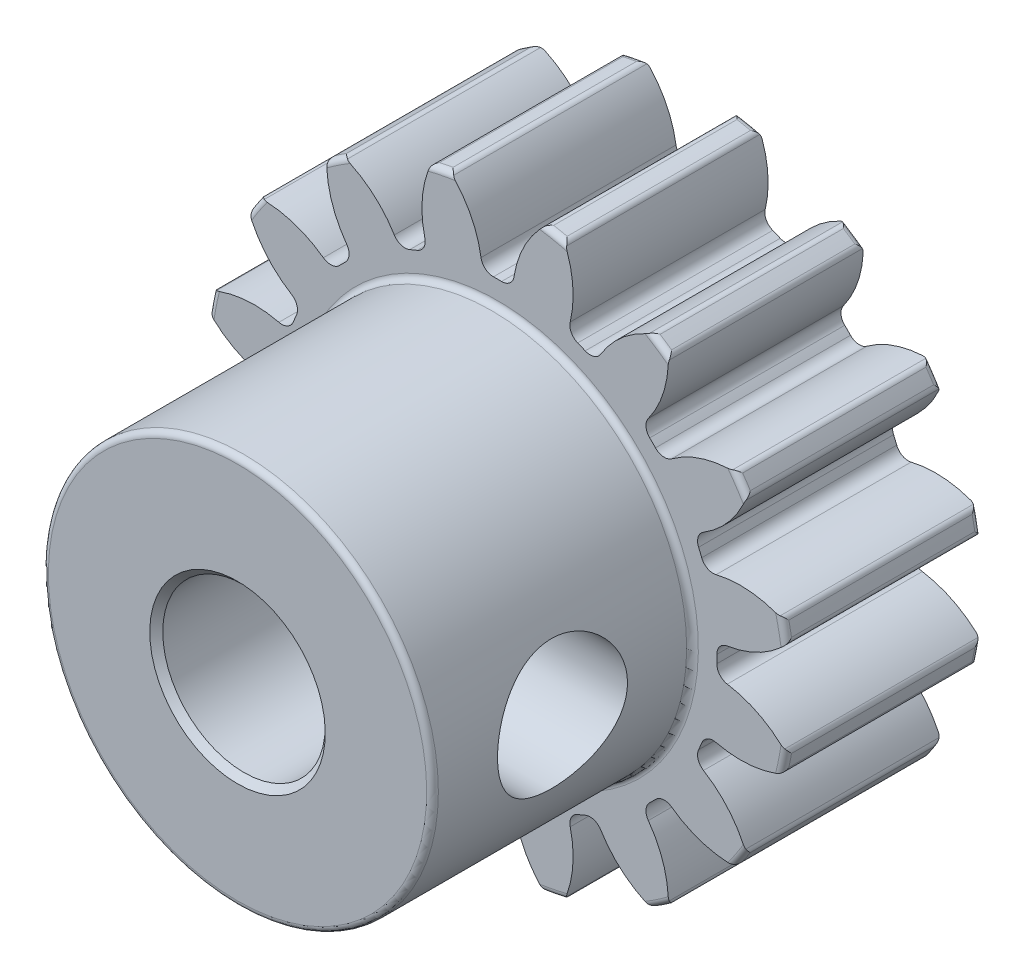
from build123d import *

# Parameters (mm, degrees)
FILLET2_R                = 0.18
CUT_EXTRUDE2_DEPTH       = 16.033296498
FILLET3_R                = 0.380000002
FILLET4_START            = -1
FILLET4_DEPTH            = 8
CIRPATTERN1_COUNT        = 16
FILLET3_OF_CIRPATTERN1_R = 0.380000002
CUT_EXTRUDE3_REACH       = 24.265
CUT_EXTRUDE3_END_RADIUS  = 2.5
SKETCH8_R                = 2
CHAMFER1_SIZE            = 0.2


with BuildPart() as part:
    # Sketch4 → Revolve1 (revolve)
    with BuildSketch(Plane(origin=(0, 0, 0), x_dir=(0, 0, -1), z_dir=(1, 0, 0))):
        Polygon((-14, 2.5), (-14, 6), (-6, 6), (-6, 9), (0, 9), (0, 2.5), align=None)
    revolve(axis=Axis((0, 0, 6), (0, 0, 1)))

    # Fillet2
    fillet2_edges = [part.edges().sort_by_distance(p)[0] for p in [
        (0, -9, 0),
        (0, -9, 6),
        (0, -6, 6),
        (0, -6, 14),
    ]]
    fillet(fillet2_edges, radius=FILLET2_R)

    # Sketch7 → Cut-Extrude2 (cut, through all)
    with BuildSketch(Plane.XY.offset(6)):
        with BuildLine():
            ThreePointArc((-1.449653973, 8.88248295), (0, 9), (1.449653973, 8.88248295))
            ThreePointArc((1.449653973, 8.88248295), (0.756020423, 7.901265339), (0.473194462, 6.733393352))
            ThreePointArc((0.473194462, 6.733393352), (0, 6.749999928), (-0.473194462, 6.733393352))
            ThreePointArc((-0.473194462, 6.733393352), (-0.756020423, 7.901265339), (-1.449653973, 8.88248295))
        make_face()
    cut_extrude2 = extrude(amount=-CUT_EXTRUDE2_DEPTH, mode=Mode.SUBTRACT)

    # Fillet3
    fillet3_edges = [part.edges().sort_by_distance(p)[0] for p in [
        (-0.473194462, 6.733393352, 3),
        (0.473194462, 6.733393352, 3),
    ]]
    fillet(fillet3_edges, radius=FILLET3_R)

    # Fillet4: read off the stored shape, not the designer's step
    # Fillet4 outline → Fillet4 (cut)
    with BuildSketch(Plane.XY.offset(FILLET4_START)):
        with BuildLine():
            ThreePointArc((-1.449653973, 8.88248295), (-1.498324726, 8.874402685), (-1.546950452, 8.866055735))
            ThreePointArc((-1.546950452, 8.866055735), (-1.455853265, 8.859672947), (-1.378256113, 8.811526095))
            ThreePointArc((-1.378256113, 8.811526095), (-1.413677724, 8.847286973), (-1.449653973, 8.88248295))
        make_face()
        with BuildLine():
            ThreePointArc((1.378256113, 8.811526095), (1.455853265, 8.859672947), (1.546950452, 8.866055735))
            ThreePointArc((1.546950452, 8.866055735), (1.498324726, 8.874402685), (1.449653973, 8.88248295))
            ThreePointArc((1.449653973, 8.88248295), (1.413677724, 8.847286973), (1.378256113, 8.811526095))
        make_face()
    fillet4 = extrude(amount=FILLET4_DEPTH, mode=Mode.SUBTRACT)

    # CirPattern1: Cut-Extrude2, Fillet4 ×16 about axis
    cirpattern1_axis = Axis((0, 0, 0), (0, 0, 1))
    add([cut_extrude2.rotate(cirpattern1_axis, i * 360 / CIRPATTERN1_COUNT) for i in range(1, CIRPATTERN1_COUNT)], mode=Mode.SUBTRACT)
    add([fillet4.rotate(cirpattern1_axis, i * 360 / CIRPATTERN1_COUNT) for i in range(1, CIRPATTERN1_COUNT)], mode=Mode.SUBTRACT)

    # Fillet3 of CirPattern1
    fillet3_of_cirpattern1_edges = [part.edges().sort_by_distance(p)[0] for p in [
        (-3.013932758, 6.039760621, 3),
        (-2.139583401, 6.401927983, 3),
        (-5.095827112, 4.426629086, 3),
        (-4.426629086, 5.095827112, 3),
        (-6.401927983, 2.139583401, 3),
        (-6.039760621, 3.013932758, 3),
        (-6.733393352, -0.473194462, 3),
        (-6.733393352, 0.473194462, 3),
        (-6.039760621, -3.013932758, 3),
        (-6.401927983, -2.139583401, 3),
        (-4.426629086, -5.095827112, 3),
        (-5.095827112, -4.426629086, 3),
        (-2.139583401, -6.401927983, 3),
        (-3.013932758, -6.039760621, 3),
        (0.473194462, -6.733393352, 3),
        (-0.473194462, -6.733393352, 3),
        (3.013932758, -6.039760621, 3),
        (2.139583401, -6.401927983, 3),
        (5.095827112, -4.426629086, 3),
        (4.426629086, -5.095827112, 3),
        (6.401927983, -2.139583401, 3),
        (6.039760621, -3.013932758, 3),
        (6.733393352, 0.473194462, 3),
        (6.733393352, -0.473194462, 3),
        (6.039760621, 3.013932758, 3),
        (6.401927983, 2.139583401, 3),
        (4.426629086, 5.095827112, 3),
        (5.095827112, 4.426629086, 3),
        (2.139583401, 6.401927983, 3),
        (3.013932758, 6.039760621, 3),
    ]]
    fillet(fillet3_of_cirpattern1_edges, radius=FILLET3_OF_CIRPATTERN1_R)

    # Cut-Extrude3: up to this cylinder (the profile starts outside it)
    cut_extrude3_end = Plane(origin=(0, 0, 10), z_dir=(0, 0, -1)) * Cylinder(CUT_EXTRUDE3_END_RADIUS, 54.53, mode=Mode.PRIVATE)
    # Sketch8 → Cut-Extrude3 (cut, up to the surface)
    with BuildSketch(Plane(origin=(6, 0, 0), x_dir=(0, 0, -1), z_dir=(1, 0, 0)), mode=Mode.PRIVATE) as cut_extrude3_sk1:
        with Locations((-10, 0)):
            Circle(SKETCH8_R)
    cut_extrude3_tool1 = extrude(cut_extrude3_sk1.sketch, amount=-CUT_EXTRUDE3_REACH, mode=Mode.PRIVATE) - cut_extrude3_end
    add(cut_extrude3_tool1.solids().sort_by_distance((6, 0, 10))[0], mode=Mode.SUBTRACT)

    # Chamfer1
    chamfer1_edges = [part.edges().sort_by_distance(p)[0] for p in [
        (0, -2.5, 0),
        (0, -2.5, 14),
    ]]
    chamfer(chamfer1_edges, length=CHAMFER1_SIZE)


solid = part.part
